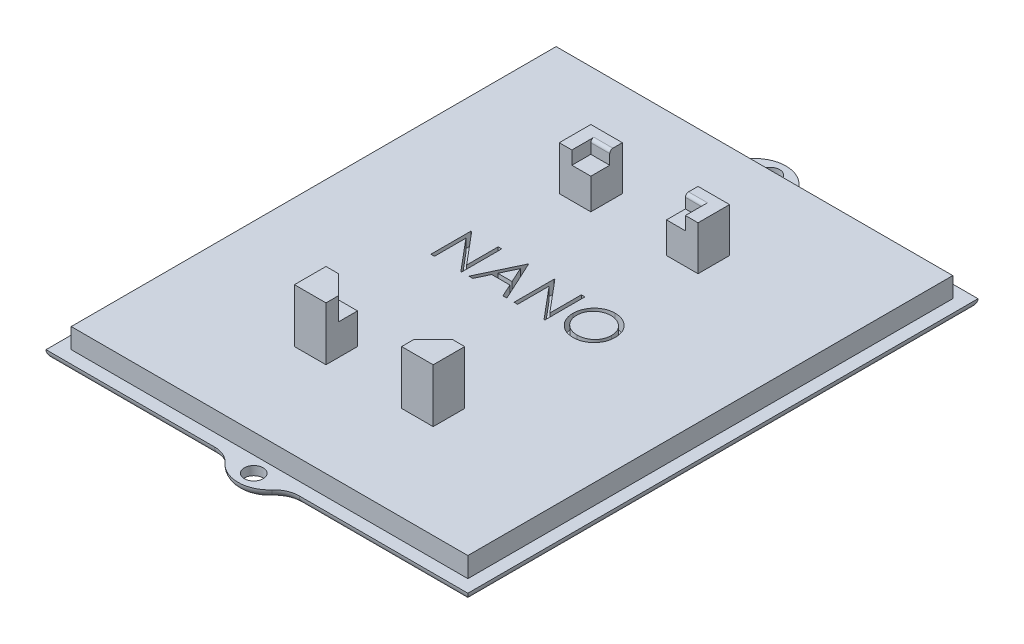
from build123d import *

# Parameters (mm, degrees)
SKETCH1_W           = 62.9
SKETCH1_H           = 76.9
BOSS_EXTRUDE1_DEPTH = 4.575
SKETCH6_W           = 66.9
SKETCH6_H           = 80.9
BOSS_EXTRUDE4_DEPTH = 1.4
BOSS_EXTRUDE3_DEPTH = 1.4
CUT_EXTRUDE2_REACH  = 56.926
SKETCH7_R           = 1.5
FILLET1_R           = 1.4
SKETCH2_W           = 5
SKETCH2_H           = 5
BOSS_EXTRUDE2_DEPTH = 7
LETTERS_DEPTH       = 2
SKETCH8_W           = 18
SKETCH8_H           = 43
CUT_EXTRUDE3_DEPTH  = 2.1
BOSS_EXTRUDE5_DEPTH = 1.5
FILLET2_R           = 0.5
FILLET3_R           = 0.5


with BuildPart() as part:
    # Sketch1 → Boss-Extrude1 (new body)
    with BuildSketch(Plane(origin=(0, 0, 0), x_dir=(1, 0, 0), z_dir=(0, 1, 0))):
        Rectangle(SKETCH1_W, SKETCH1_H)
    extrude(amount=BOSS_EXTRUDE1_DEPTH)

    # Sketch6 → Boss-Extrude4 (add)
    with BuildSketch(Plane.XZ):
        Rectangle(SKETCH6_W, SKETCH6_H)
    extrude(amount=-BOSS_EXTRUDE4_DEPTH)

    # Sketch4 → Boss-Extrude3 (add)
    with BuildSketch(Plane(origin=(0, 0, 0), x_dir=(1, 0, 0), z_dir=(0, 1, 0))):
        with BuildLine():
            Line((6.708203932, -40.45), (-6.708203932, -40.45))
            ThreePointArc((-6.708203932, -40.45), (-5.075210771, -40.798516283), (-3.726779962, -41.783333333))
            ThreePointArc((-3.726779962, -41.783333333), (0, -43.45), (3.726779962, -41.783333333))
            ThreePointArc((3.726779962, -41.783333333), (5.075210771, -40.798516283), (6.708203932, -40.45))
        make_face()
    boss_extrude3 = extrude(amount=BOSS_EXTRUDE3_DEPTH)

    # Sketch7 → Cut-Extrude2 (cut, up to next)
    with BuildSketch(Plane(origin=(0, 1.4, 0), x_dir=(1, 0, 0), z_dir=(0, 1, 0)), mode=Mode.PRIVATE) as cut_extrude2_sk1:
        with Locations(Location((0, -40.95, 0), (0, 0, 270))):
            Circle(SKETCH7_R)
    cut_extrude2_tool1 = extrude(cut_extrude2_sk1.sketch, amount=-CUT_EXTRUDE2_REACH, mode=Mode.PRIVATE) & part.part
    cut_extrude2 = cut_extrude2_tool1.solids().sort_by_distance((0, 1.4, 40.95))[0]
    add(cut_extrude2, mode=Mode.SUBTRACT)

    # Mirror1: Boss-Extrude3, Cut-Extrude2 across plane
    add(boss_extrude3.mirror(Plane.XY))
    add(cut_extrude2.mirror(Plane.XY), mode=Mode.SUBTRACT)

    # Fillet1
    # the kernel refuses this fillet: 1.4 mm, written as the material it takes off along each edge
    with BuildSketch(Plane(origin=(33.45, 0, -43.95), x_dir=(-1, 0, 0), z_dir=(0, 0, 1)), Plane(origin=(-33.45, 0, 43.95), x_dir=(1, 0, 0), z_dir=(0, 0, -1))) as fillet1_piece_1:
        with BuildLine():
            CenterArc((FILLET1_R, -FILLET1_R), FILLET1_R, 90, 90)
            Line((0, -FILLET1_R), (0, 0))
            Line((0, 0), (FILLET1_R, 0))
        make_face()
    extrude(amount=87.9, mode=Mode.SUBTRACT)
    with BuildSketch(Plane(origin=(6.708203932, 0, -40.45), x_dir=(0, 0, 1), z_dir=(1, 0, 0)), Plane(origin=(-36.95, 0, -40.45), x_dir=(0, 0, 1), z_dir=(1, 0, 0)), Plane(origin=(-6.708203932, 0, 40.45), x_dir=(0, 0, -1), z_dir=(-1, 0, 0)), Plane(origin=(36.95, 0, 40.45), x_dir=(0, 0, -1), z_dir=(-1, 0, 0))) as fillet1_piece_2:
        with BuildLine():
            CenterArc((FILLET1_R, -FILLET1_R), FILLET1_R, 90, 90)
            Line((0, -FILLET1_R), (0, 0))
            Line((0, 0), (FILLET1_R, 0))
        make_face()
    extrude(amount=30.241796068, mode=Mode.SUBTRACT)
    with BuildSketch(Plane(origin=(6.708203932, 0, -44.45), x_dir=(-0.7453559924999283, 0, 0.6666666666666684), z_dir=(-0.6666666666666684, 0, -0.7453559924999283))) as fillet1_piece_3:
        with BuildLine():
            CenterArc((4 + FILLET1_R, FILLET1_R), FILLET1_R, 180, 90)
            Line((4, FILLET1_R), (4, 0))
            Line((4, 0), (4 + FILLET1_R, 0))
        make_face()
    revolve(axis=Axis((6.708203932, 0, -44.45), (0, 1, 0)), revolution_arc=48.189685104, mode=Mode.SUBTRACT)
    with BuildSketch(Plane(origin=(0, 0, -38.45), x_dir=(-0.7453559924999277, 0, -0.6666666666666692), z_dir=(-0.6666666666666692, 0, 0.7453559924999277))) as fillet1_piece_4:
        with BuildLine():
            CenterArc((5 - FILLET1_R, -FILLET1_R), FILLET1_R, 0, 90)
            Line((5, -FILLET1_R), (5, 0))
            Line((5, 0), (5 - FILLET1_R, 0))
        make_face()
    revolve(axis=Axis((0, 0, -38.45), (0, -1, 0)), revolution_arc=96.379370208, mode=Mode.SUBTRACT)
    with BuildSketch(Plane(origin=(-6.708203932, 0, -44.45), x_dir=(0, 0, 1), z_dir=(-1, 0, 0))) as fillet1_piece_5:
        with BuildLine():
            CenterArc((4 + FILLET1_R, FILLET1_R), FILLET1_R, 180, 90)
            Line((4, FILLET1_R), (4, 0))
            Line((4, 0), (4 + FILLET1_R, 0))
        make_face()
    revolve(axis=Axis((-6.708203932, 0, -44.45), (0, 1, 0)), revolution_arc=48.189685104, mode=Mode.SUBTRACT)
    with BuildSketch(Plane(origin=(-6.708203932, 0, 44.45), x_dir=(0, 0, -1), z_dir=(-1, 0, 0))) as fillet1_piece_6:
        with BuildLine():
            CenterArc((4 + FILLET1_R, -FILLET1_R), FILLET1_R, 90, 90)
            Line((4, -FILLET1_R), (4, 0))
            Line((4, 0), (4 + FILLET1_R, 0))
        make_face()
    revolve(axis=Axis((-6.708203932, 0, 44.45), (0, -1, 0)), revolution_arc=48.189685104, mode=Mode.SUBTRACT)
    with BuildSketch(Plane(origin=(0, 0, 38.45), x_dir=(-0.7453559924999277, 0, 0.6666666666666692), z_dir=(-0.6666666666666692, 0, -0.7453559924999277))) as fillet1_piece_7:
        with BuildLine():
            CenterArc((5 - FILLET1_R, FILLET1_R), FILLET1_R, 270, 90)
            Line((5, FILLET1_R), (5, 0))
            Line((5, 0), (5 - FILLET1_R, 0))
        make_face()
    revolve(axis=Axis((0, 0, 38.45), (0, 1, 0)), revolution_arc=96.379370208, mode=Mode.SUBTRACT)
    with BuildSketch(Plane(origin=(6.708203932, 0, 44.45), x_dir=(-0.7453559924999283, 0, -0.6666666666666684), z_dir=(-0.6666666666666684, 0, 0.7453559924999283))) as fillet1_piece_8:
        with BuildLine():
            CenterArc((4 + FILLET1_R, -FILLET1_R), FILLET1_R, 90, 90)
            Line((4, -FILLET1_R), (4, 0))
            Line((4, 0), (4 + FILLET1_R, 0))
        make_face()
    revolve(axis=Axis((6.708203932, 0, 44.45), (0, -1, 0)), revolution_arc=48.189685104, mode=Mode.SUBTRACT)

    # Sketch2 → Boss-Extrude2 (add)
    with BuildSketch(Plane(origin=(0, 4.575, 0), x_dir=(1, 0, 0), z_dir=(0, 1, 0))):
        with Locations((-8.5, -21)):
            Rectangle(SKETCH2_W, SKETCH2_H)
        with Locations((8.5, -21)):
            Rectangle(SKETCH2_W, SKETCH2_H)
        with Locations((-8.5, 21)):
            Rectangle(SKETCH2_W, SKETCH2_H)
        with Locations((8.5, 21)):
            Rectangle(SKETCH2_W, SKETCH2_H)
    extrude(amount=BOSS_EXTRUDE2_DEPTH)

    # Sketch5 → Letters (cut)
    # profile 1 of 4: a face of its own
    with BuildSketch(Plane(origin=(0, 4.575, 0), x_dir=(1, 0, 0), z_dir=(0, 1, 0))):
        Polygon((-12.862820513, 0), (-12.862820513, 6.35), (-12.743249199, 6.35), (-8.548076923, 1.352173478), (-8.548076923, 6.35), (-7.978205128, 6.35), (-7.978205128, 0), (-8.107952724, 0), (-12.292948718, 4.986378205), (-12.292948718, 0), align=None)
    # profile 2 of 4: a face of its own
    with BuildSketch(Plane(origin=(0, 4.575, 0), x_dir=(1, 0, 0), z_dir=(0, 1, 0))):
        Polygon((-3.744871795, 6.35), (-0.814102564, 0), (-1.433583734, 0), (-2.372345753, 2.03525641), (-5.250961538, 2.03525641), (-6.216436298, 0), (-6.838461538, 0), (-3.826282051, 6.35), align=None)
        Polygon((-3.791937099, 5.112309696), (-4.941856971, 2.686538462), (-2.672546074, 2.686538462), align=None, mode=Mode.SUBTRACT)
    # profile 3 of 4: a face of its own
    with BuildSketch(Plane(origin=(0, 4.575, 0), x_dir=(1, 0, 0), z_dir=(0, 1, 0))):
        Polygon((0.325641026, 0), (0.325641026, 6.35), (0.44521234, 6.35), (4.640384615, 1.352173478), (4.640384615, 6.35), (5.21025641, 6.35), (5.21025641, 0), (5.080508814, 0), (0.895512821, 4.986378205), (0.895512821, 0), align=None)
    # profile 4 of 4: a face of its own
    with BuildSketch(Plane(origin=(0, 4.575, 0), x_dir=(1, 0, 0), z_dir=(0, 1, 0))):
        with BuildLine():
            add(Edge.make_bspline(
                [(9.809935897, 6.512820513), (9.927516318, 6.5098424), (10.158453965, 6.503993141), (10.49786128, 6.459218196), (10.82188381, 6.38175656), (11.133161062, 6.278590864), (11.427969748, 6.140969336), (11.708528881, 5.974626281), (11.974170924, 5.777818991), (12.22131543, 5.552068823), (12.447478754, 5.306444556), (12.646734291, 5.044320348), (12.813725309, 4.767281093), (12.950859523, 4.4761593), (13.058444144, 4.171613358), (13.13268298, 3.852019667), (13.180105053, 3.519448958), (13.185649106, 3.292614503), (13.188461538, 3.177544071)],
                knots=[0, 0, 0, 0, 1.065120563, 2.091984664, 3.0946048, 4.079830382, 5.057816894, 6.036188127, 7.030412546, 8.04752943, 9.064399622, 10.05169764, 11.02544977, 11.989514704, 12.962713494, 13.945757189, 14.957906945, 16, 16, 16, 16], degree=3))
            add(Edge.make_bspline(
                [(13.188461538, 3.177544071), (13.185649518, 3.063321275), (13.1801067, 2.838174912), (13.132629061, 2.507714663), (13.058168961, 2.190050114), (12.951858592, 1.885711573), (12.815378081, 1.594377993), (12.647275128, 1.316815948), (12.449261788, 1.052934444), (12.223915073, 0.805624322), (11.978258897, 0.578843197), (11.714769698, 0.381233237), (11.439373246, 0.211190896), (11.148525633, 0.075511945), (10.846084138, -0.032931396), (10.529341923, -0.106868311), (10.199783175, -0.154560518), (9.975045782, -0.160036968), (9.860817308, -0.162820513)],
                knots=[0, 0, 0, 0, 1.043624062, 2.057103931, 3.04512605, 4.022047818, 4.998200453, 5.980619268, 6.982898556, 8.009068085, 9.034988726, 10.034168286, 11.015286542, 11.987931943, 12.962482838, 13.94673481, 14.956375938, 16, 16, 16, 16], degree=3))
            add(Edge.make_bspline(
                [(9.860817308, -0.162820513), (9.745747472, -0.160009482), (9.518914194, -0.154468193), (9.185925573, -0.106967644), (8.866107381, -0.032688422), (8.560374201, 0.073464412), (8.268555543, 0.210655674), (7.990080678, 0.377940762), (7.726067368, 0.576436575), (7.478704485, 0.801710217), (7.252373797, 1.046950033), (7.055053216, 1.309720753), (6.88773051, 1.584867082), (6.750999892, 1.87315259), (6.642751516, 2.173183636), (6.568901346, 2.486961588), (6.521120405, 2.812697548), (6.515614326, 3.034481092), (6.512820513, 3.147015224)],
                knots=[0, 0, 0, 0, 1.053102029, 2.075944431, 3.073151272, 4.055350789, 5.033113405, 6.020478099, 7.024410459, 8.052272461, 9.079885166, 10.07527673, 11.055994387, 12.023226415, 12.992069828, 13.970394897, 14.97016774, 16, 16, 16, 16], degree=3))
            add(Edge.make_bspline(
                [(6.512820513, 3.147015224), (6.513790494, 3.222548781), (6.515718221, 3.372663005), (6.538926006, 3.595578123), (6.572602235, 3.814908316), (6.620865705, 4.030029893), (6.683987729, 4.240416251), (6.758467836, 4.447518349), (6.849435841, 4.649237391), (6.952270731, 4.846528973), (7.067045726, 5.036317602), (7.1938203, 5.215713417), (7.328141611, 5.386221797), (7.475395197, 5.543424219), (7.63072789, 5.691893852), (7.796659519, 5.829349067), (7.972177591, 5.957029336), (8.158037337, 6.072091954), (8.349659064, 6.176157813), (8.547192647, 6.265460314), (8.747955284, 6.34210674), (8.952887288, 6.40422938), (9.16144446, 6.453273217), (9.374081984, 6.486669416), (9.590630457, 6.509936392), (9.736519564, 6.511855003), (9.809935897, 6.512820513)],
                knots=[0, 0, 0, 0, 1.037015668, 2.060948919, 3.074880161, 4.083647147, 5.086022904, 6.090072063, 7.104153813, 8.122640571, 9.144368836, 10.147691507, 11.138137339, 12.123020368, 13.103399296, 14.087645067, 15.080126199, 16.082011238, 17.087798457, 18.072939717, 19.057185487, 20.037253025, 21.01195951, 21.997135196, 22.992090687, 24, 24, 24, 24], degree=3))
        make_face()
        with BuildLine():
            add(Edge.make_bspline(
                [(9.837920673, 5.861538462), (9.777659838, 5.860803875), (9.657714265, 5.859341724), (9.479398035, 5.840081783), (9.303426955, 5.812631842), (9.129764684, 5.773476797), (8.959137845, 5.720129444), (8.78995599, 5.658732368), (8.623761878, 5.583945532), (8.461104164, 5.49944934), (8.303415385, 5.405924869), (8.154620913, 5.302561806), (8.014335544, 5.191784144), (7.88290276, 5.073333353), (7.760708491, 4.946606218), (7.645347675, 4.813523941), (7.541444292, 4.670282653), (7.446220459, 4.520766629), (7.361007378, 4.365170618), (7.285233091, 4.205132725), (7.223249818, 4.039347493), (7.172699507, 3.869613521), (7.13078985, 3.69619963), (7.104239731, 3.517790305), (7.084768164, 3.33528203), (7.083389587, 3.211943523), (7.082692308, 3.149559295)],
                knots=[0, 0, 0, 0, 1.008559885, 2.007477868, 2.99961109, 3.989939068, 4.984837346, 5.991145699, 7.001802488, 8.033829008, 9.059044045, 10.069351652, 11.065060232, 12.050310815, 13.029377138, 14.011219647, 14.996725999, 15.989392538, 16.977580475, 17.965360261, 18.951710183, 19.937753436, 20.929683414, 21.935841486, 22.955955122, 24, 24, 24, 24], degree=3))
            add(Edge.make_bspline(
                [(7.082692308, 3.149559295), (7.085005272, 3.05782498), (7.089555587, 2.877355204), (7.129392893, 2.612890143), (7.190755618, 2.358729966), (7.281211125, 2.116265359), (7.394332955, 1.88341216), (7.534081742, 1.662236027), (7.699651797, 1.452677184), (7.887727052, 1.256198625), (8.09332682, 1.076864094), (8.311644773, 0.919450481), (8.540342032, 0.786263314), (8.780014986, 0.677759825), (9.029384092, 0.591781301), (9.29005622, 0.532855784), (9.560294911, 0.494074601), (9.744500529, 0.490350315), (9.837920673, 0.488461538)],
                knots=[0, 0, 0, 0, 1.032063989, 2.030389145, 3.003944642, 3.970395727, 4.937377036, 5.913328081, 6.909231446, 7.93887556, 8.970685674, 9.976071282, 10.964166581, 11.944589148, 12.933237628, 13.927779006, 14.949070134, 16, 16, 16, 16], degree=3))
            add(Edge.make_bspline(
                [(9.837920673, 0.488461538), (9.900712197, 0.489324239), (10.025246649, 0.491035234), (10.210477097, 0.508268548), (10.39237051, 0.535903511), (10.57067176, 0.575691986), (10.745178489, 0.62548906), (10.916619061, 0.684648795), (11.083167388, 0.758456122), (11.246924522, 0.840004549), (11.403671989, 0.932968834), (11.553306169, 1.032823763), (11.692055447, 1.143438261), (11.823389905, 1.260129149), (11.946085855, 1.385249273), (12.059313583, 1.518635961), (12.162691823, 1.661131154), (12.257879496, 1.81042039), (12.342793987, 1.966442163), (12.416778924, 2.127060293), (12.479546163, 2.291879277), (12.53021645, 2.461136842), (12.569922931, 2.634511525), (12.597282214, 2.812235467), (12.616420095, 2.993953131), (12.617862593, 3.116859841), (12.618589744, 3.178816106)],
                knots=[0, 0, 0, 0, 1.047197238, 2.076906641, 3.100256066, 4.114471768, 5.12198147, 6.126382909, 7.136867548, 8.15857795, 9.17633901, 10.174870724, 11.156907918, 12.133735059, 13.104061851, 14.077631395, 15.04955518, 16.038496417, 17.029181396, 18.010275684, 18.986308667, 19.968651475, 20.955262928, 21.950658345, 22.966943676, 24, 24, 24, 24], degree=3))
            add(Edge.make_bspline(
                [(12.618589744, 3.178816106), (12.61786201, 3.240348521), (12.616418417, 3.3624094), (12.597291355, 3.542859742), (12.569894026, 3.719304854), (12.530410255, 3.89105204), (12.479519262, 4.058145078), (12.416767963, 4.220427035), (12.342771777, 4.378502474), (12.257848284, 4.531980699), (12.162388147, 4.679254866), (12.058077163, 4.820047815), (11.943114317, 4.951715503), (11.820784243, 5.077508448), (11.688031351, 5.194743762), (11.545456989, 5.303460335), (11.394792031, 5.406281847), (11.235266904, 5.499038223), (11.070631445, 5.584698331), (10.901696121, 5.658088008), (10.730374754, 5.720448853), (10.557103008, 5.773638204), (10.380422461, 5.812478488), (10.201526943, 5.840106521), (10.02066396, 5.859335021), (9.899028404, 5.860801651), (9.837920673, 5.861538462)],
                knots=[0, 0, 0, 0, 1.02996197, 2.043119294, 3.035359645, 4.018872909, 4.991431989, 5.957985074, 6.929999688, 7.912076566, 8.892894881, 9.867085534, 10.843653904, 11.817741046, 12.803660682, 13.806313499, 14.818574707, 15.856120519, 16.894564902, 17.924820532, 18.937903209, 19.946497019, 20.957711757, 21.963978472, 22.977135795, 24, 24, 24, 24], degree=3))
        make_face(mode=Mode.SUBTRACT)
    extrude(amount=-LETTERS_DEPTH, mode=Mode.SUBTRACT)

    # Sketch8 → Cut-Extrude3 (cut)
    with BuildSketch(Plane(origin=(0, 11.575, 0), x_dir=(1, 0, 0), z_dir=(0, 1, 0))):
        Rectangle(SKETCH8_W, SKETCH8_H)
    extrude(amount=-CUT_EXTRUDE3_DEPTH, mode=Mode.SUBTRACT)

    # Sketch10 → Boss-Extrude5 (add)
    with BuildSketch(Plane(origin=(0, 11.575, 0), x_dir=(1, 0, 0), z_dir=(0, 1, 0))):
        Polygon((-11, -18.5), (-11, -23.5), (-6, -23.5), (-6, -21.5), (-9, -18.5), align=None)
        Polygon((6, -21.5), (6, -23.5), (11, -23.5), (11, -18.5), (9, -18.5), align=None)
    extrude(amount=BOSS_EXTRUDE5_DEPTH)

    # Fillet2
    fillet2_edges = [part.edges().sort_by_distance(p)[0] for p in [
        (-7.5, 11.575, 20),
        (7.5, 11.575, 20),
    ]]
    fillet(fillet2_edges, radius=FILLET2_R)

    # Fillet3
    fillet3_edges = [part.edges().sort_by_distance(p)[0] for p in [
        (-7.5, 11.575, -21.5),
        (7.5, 11.575, -21.5),
    ]]
    fillet(fillet3_edges, radius=FILLET3_R)


solid = part.part
